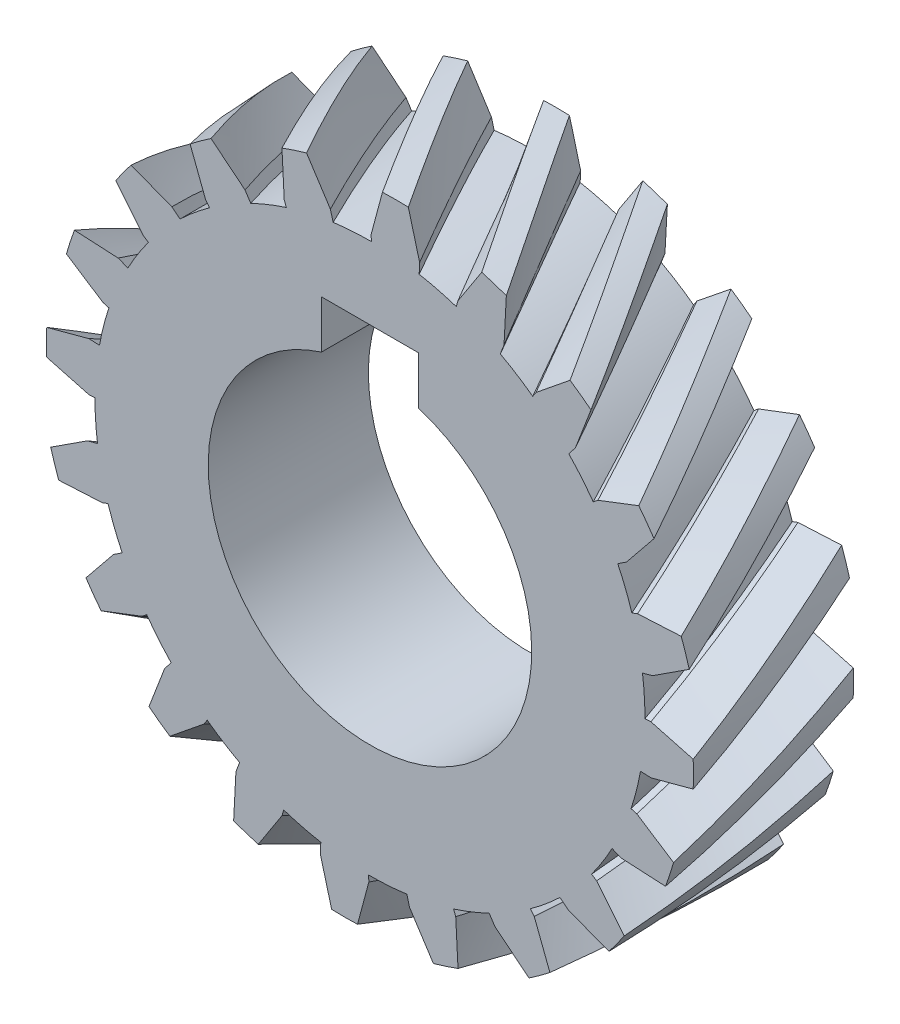
from build123d import *

# Parameters (mm, degrees)
SKETCH5_R           = 8.5
SKETCH5_R_2         = 5
BOSS_EXTRUDE1_DEPTH = 10
SWEEP1_PITCH        = 100
SWEEP1_HEIGHT       = 10
SWEEP1_RADIUS       = 8.5
SWEEP1_START_ANGLE  = 90
CIRPATTERN1_COUNT   = 20
SKETCH8_R           = 21.012114293
CUT_EXTRUDE1_DEPTH  = 0.05
SKETCH10_R          = 21.679330756
CUT_EXTRUDE2_DEPTH  = 5
SKETCH11_W          = 3
SKETCH11_H          = 2.5
CUT_EXTRUDE4_DEPTH  = 4.95


with BuildPart() as part:
    # Sketch5 → Boss-Extrude1 (new body)
    with BuildSketch(Plane.XY):
        with Locations((-0.785181751, 0)):
            Circle(SKETCH5_R)
        with Locations((-0.785181751, 0)):
            Circle(SKETCH5_R_2, mode=Mode.SUBTRACT)
    extrude(amount=BOSS_EXTRUDE1_DEPTH)

    # Sweep1: sweep along a helix
    with BuildLine() as sweep1_path:
        add(Helix(SWEEP1_PITCH, SWEEP1_HEIGHT, SWEEP1_RADIUS, center=(-0.785181751, 0, 10), direction=(0, 0, -1), lefthand=True, mode=Mode.PRIVATE).rotate(Axis((-0.785181751, 0, 10), (0, 0, -1)), SWEEP1_START_ANGLE))
    # Sketch2 → Sweep1 (sweep)
    with BuildSketch(Plane.XY.offset(10)):
        with BuildLine():
            ThreePointArc((0.727941176, 8.217822196), (0, 8.25), (-0.727941176, 8.217822196))
            Line((-0.727941176, 8.217822196), (-0.75, 8.685779015))
            Line((-0.75, 8.685779015), (-0.4, 9.991996797))
            ThreePointArc((-0.4, 9.991996797), (0, 10), (0.4, 9.991996797))
            Line((0.4, 9.991996797), (0.75, 8.685779015))
            Line((0.75, 8.685779015), (0.727941176, 8.217822196))
        make_face()
    sweep1 = sweep(path=sweep1_path.line, is_frenet=True)

    # CirPattern1: Sweep1 ×20 about axis
    cirpattern1_axis = Axis((-0.785181751, 0, 10), (0, 0, -1))
    for i in range(1, CIRPATTERN1_COUNT):
        add(sweep1.rotate(cirpattern1_axis, i * 360 / CIRPATTERN1_COUNT))

    # Sketch8 → Cut-Extrude1 (cut, symmetric)
    with BuildSketch(Plane(origin=(0, 0, 0), x_dir=(-1, 0, 0), z_dir=(0, 0, -1))):
        Circle(SKETCH8_R)
    extrude(amount=CUT_EXTRUDE1_DEPTH, both=True, mode=Mode.SUBTRACT)

    # Sketch10 → Cut-Extrude2 (cut)
    with BuildSketch(Plane(origin=(0, 0, 0.05), x_dir=(-1, 0, 0), z_dir=(0, 0, -1))):
        Circle(SKETCH10_R)
    extrude(amount=-CUT_EXTRUDE2_DEPTH, mode=Mode.SUBTRACT)

    # Sketch11 → Cut-Extrude4 (cut)
    with BuildSketch(Plane(origin=(0, 0, 5.05), x_dir=(-1, 0, 0), z_dir=(0, 0, -1))):
        with Locations((0.785181751, 5)):
            Rectangle(SKETCH11_W, SKETCH11_H)
    extrude(amount=-CUT_EXTRUDE4_DEPTH, mode=Mode.SUBTRACT)


solid = part.part
